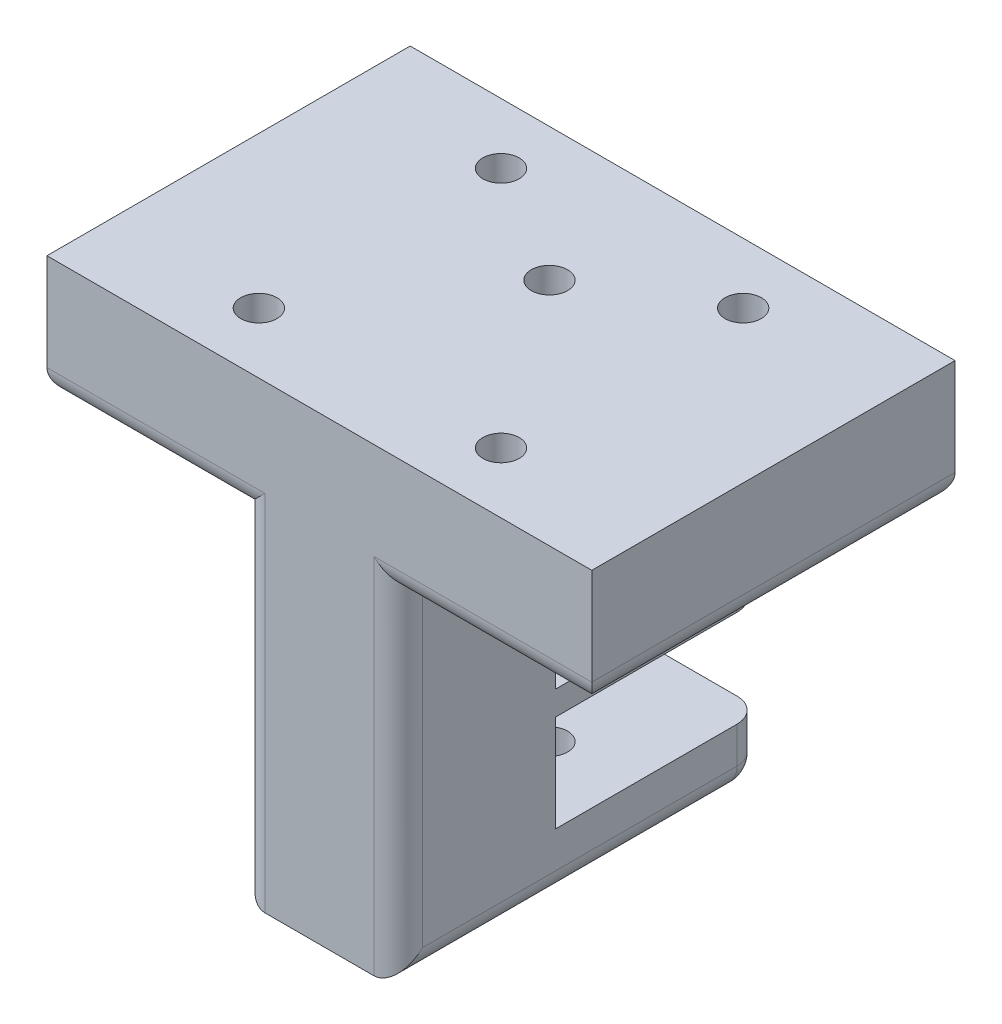
from build123d import *

# Parameters (mm, degrees)
SKETCH1_W           = 45
SKETCH1_H           = 30
SKETCH1_R           = 1.5
BOSS_EXTRUDE1_DEPTH = 10
SKETCH5_W           = 13
SKETCH5_H           = 30
BOSS_EXTRUDE2_DEPTH = 28
SKETCH7_W           = 13
SKETCH7_H           = 8
CUT_EXTRUDE1_DEPTH  = 17
SKETCH8_R           = 1.5
CUT_EXTRUDE2_DEPTH  = 48.697863598
FILLET1_R           = 2


with BuildPart() as part:
    # Sketch1 → Boss-Extrude1 (new body)
    with BuildSketch(Plane(origin=(0, 0, 0), x_dir=(1, 0, 0), z_dir=(0, 1, 0))):
        with Locations((2.00430517, -0.186349789)):
            Rectangle(SKETCH1_W, SKETCH1_H)
        with Locations((-7.99569483, -10.186349789)):
            Circle(SKETCH1_R, mode=Mode.SUBTRACT)
        with Locations((12.00430517, -10.186349789)):
            Circle(SKETCH1_R, mode=Mode.SUBTRACT)
        with Locations((-7.99569483, 9.813650211)):
            Circle(SKETCH1_R, mode=Mode.SUBTRACT)
        with Locations((12.00430517, 9.813650211)):
            Circle(SKETCH1_R, mode=Mode.SUBTRACT)
    extrude(amount=-BOSS_EXTRUDE1_DEPTH)

    # Sketch5 → Boss-Extrude2 (add)
    with BuildSketch(Plane.XZ.offset(10)):
        with Locations((2.00430517, 0.186349789)):
            Rectangle(SKETCH5_W, SKETCH5_H)
    extrude(amount=BOSS_EXTRUDE2_DEPTH)

    # Sketch7 → Cut-Extrude1 (cut)
    with BuildSketch(Plane(origin=(0, 0, -14.813650211), x_dir=(-1, 0, 0), z_dir=(0, 0, -1))):
        with Locations((-2.00430517, -29)):
            Rectangle(SKETCH7_W, SKETCH7_H)
        with Locations((-2.00430517, -19)):
            Rectangle(SKETCH7_W, SKETCH7_H)
    extrude(amount=-CUT_EXTRUDE1_DEPTH, mode=Mode.SUBTRACT)

    # Sketch8 → Cut-Extrude2 (cut, through all)
    with BuildSketch(Plane.XZ.offset(38)):
        with Locations((2.00430517, -3.813650211)):
            Circle(SKETCH8_R)
    extrude(amount=-CUT_EXTRUDE2_DEPTH, mode=Mode.SUBTRACT)

    # Fillet1
    fillet1_edges = [part.edges().sort_by_distance(p)[0] for p in [
        (8.50430517, -38, 0.186349789),
        (-4.49569483, -38, 0.186349789),
        (-12.49569483, -10, 15.186349789),
        (16.50430517, -10, 15.186349789),
        (-20.49569483, -10, 0.186349789),
        (24.50430517, -10, 0.186349789),
        (-12.49569483, -10, -14.813650211),
        (16.50430517, -10, -14.813650211),
        (8.50430517, -12.5, -14.813650211),
        (8.50430517, -24, -14.813650211),
        (8.50430517, -35.5, -14.813650211),
        (-4.49569483, -12.5, -14.813650211),
        (-4.49569483, -24, -14.813650211),
        (-4.49569483, -35.5, -14.813650211),
        (8.50430517, -24, 15.186349789),
        (-4.49569483, -24, 15.186349789),
        (2.00430517, -38, -14.813650211),
    ]]
    fillet(fillet1_edges, radius=FILLET1_R)


solid = part.part
